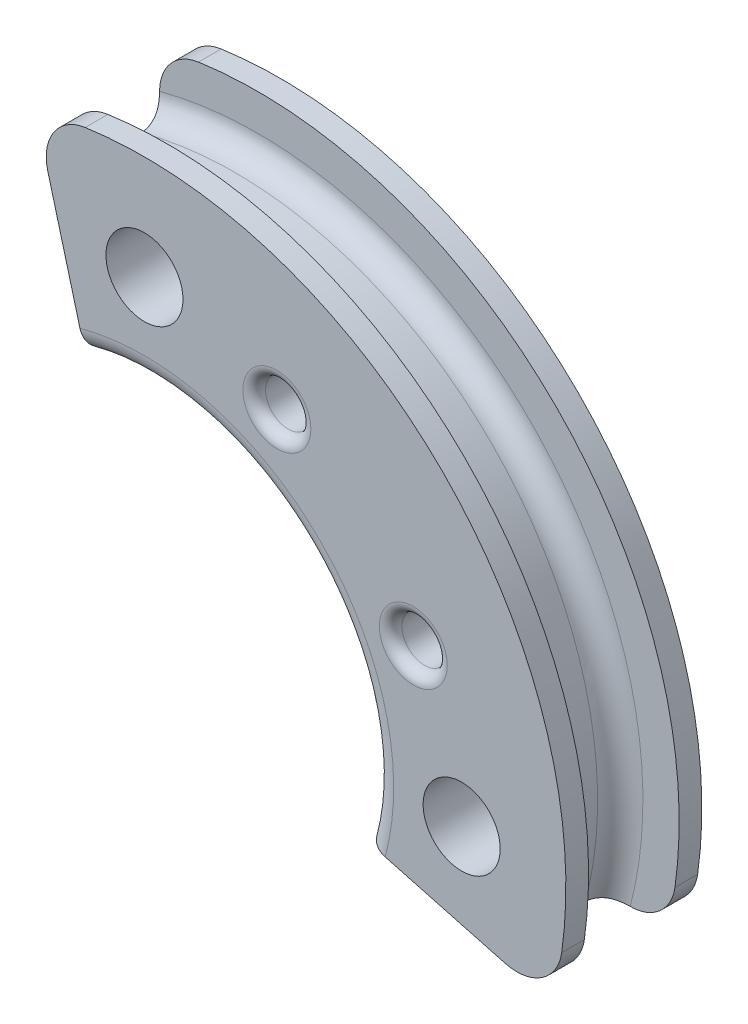
from build123d import *

# Parameters (mm, degrees)
SKETCH1_R               = 8.5
SKETCH1_R_2             = 0.85
SKETCH1_R_3             = 5
BOSS_EXTRUDE1_DEPTH     = 1.5
SKETCH7_W               = 0.8
SKETCH7_H               = 0.5
CUT_EXTRUDE1_DEPTH      = 14.237446884
CUT_EXTRUDE1_DEPTH_BACK = 14.237446884
CUT_EXTRUDE2_DEPTH      = 14.489996294
CUT_EXTRUDE2_DEPTH_BACK = 14.489996294
SKETCH5_R               = 0.5
FILLET1_R               = 0.5
FILLET2_R               = 1
CHAMFER1_SIZE           = 0.8
FILLET3_R               = 0.25


with BuildPart() as part:
    # Sketch1 → Boss-Extrude1 (new, symmetric)
    with BuildSketch(Plane.XY):
        Circle(SKETCH1_R)
        with Locations((7, 0)):
            Circle(SKETCH1_R_2, mode=Mode.SUBTRACT)
        Circle(SKETCH1_R_3, mode=Mode.SUBTRACT)
        with Locations((0, -7)):
            Circle(SKETCH1_R_2, mode=Mode.SUBTRACT)
        with Locations((-7, 0)):
            Circle(SKETCH1_R_2, mode=Mode.SUBTRACT)
        with Locations((0, 7)):
            Circle(SKETCH1_R_2, mode=Mode.SUBTRACT)
    extrude(amount=BOSS_EXTRUDE1_DEPTH, both=True)

    # Sketch2 → Cut-Revolve1 (revolve, cut)
    with BuildSketch(Plane(origin=(0, 0, 0), x_dir=(1, 0, 0), z_dir=(0, 1, 0)), mode=Mode.PRIVATE) as cut_revolve1_sk:
        with BuildLine():
            Line((-8, 0.5), (-8, -0.5))
            ThreePointArc((-8, -0.5), (-8.146446609, -0.853553391), (-8.5, -1))
            Line((-8.5, -1), (-8.5, 1))
            ThreePointArc((-8.5, 1), (-8.146446609, 0.853553391), (-8, 0.5))
        make_face()
    revolve(cut_revolve1_sk.sketch.rotate(Axis((0, 0, 0), (0, 0, -1)), 180), axis=Axis((0, 0, 0), (0, 0, -1)), mode=Mode.SUBTRACT)

    # Sketch7 → Revolve1 (revolve)
    with BuildSketch(Plane(origin=(0, 0, 0), x_dir=(1, 0, 0), z_dir=(0, 1, 0))):
        with Locations((8.9, 1.25)):
            Rectangle(SKETCH7_W, SKETCH7_H)
        with Locations((8.9, -1.25)):
            Rectangle(SKETCH7_W, SKETCH7_H)
    revolve(axis=Axis((0, 0, 0), (0, 0, -1)))

    # Sketch4 → Cut-Extrude1 (cut, two sides: drawn at the far end of the back side and taken through both)
    with BuildSketch(Plane.XY.offset(-CUT_EXTRUDE1_DEPTH_BACK)):
        Polygon((-2.654263152, 9.905844942), (0, 0), (10.350145374, -2.773313095), (10.350145374, -11.033622271), (-11.334173843, -11.033622271), (-11.334173843, 9.905844942), align=None)
    extrude(amount=CUT_EXTRUDE1_DEPTH + CUT_EXTRUDE1_DEPTH_BACK, mode=Mode.SUBTRACT)

    # Sketch5 → Cut-Extrude2 (cut, two sides: drawn at the far end of the back side and taken through both)
    with BuildSketch(Plane.XY.offset(1.5).offset(-CUT_EXTRUDE2_DEPTH_BACK)):
        with Locations((2.922350839, 5.932300352)):
            Circle(SKETCH5_R)
        with Locations((5.932300352, 2.922350839)):
            Circle(SKETCH5_R)
    extrude(amount=CUT_EXTRUDE2_DEPTH + CUT_EXTRUDE2_DEPTH_BACK, mode=Mode.SUBTRACT)

    # Fillet1
    fillet1_edges = [part.edges().sort_by_distance(p)[0] for p in [
        (3.535533906, 3.535533906, 1.5),
        (3.535533906, 3.535533906, -1.5),
    ]]
    fillet(fillet1_edges, radius=FILLET1_R)

    # Fillet2
    fillet2_edges = [part.edges().sort_by_distance(p)[0] for p in [
        (8.983110184, -2.407017119, -1.25),
        (8.983110184, -2.407017119, 1.25),
        (-2.407017119, 8.983110184, -1.25),
        (-2.407017119, 8.983110184, 1.25),
    ]]
    fillet(fillet2_edges, radius=FILLET2_R)

    # Chamfer1
    # the kernel refuses this chamfer: 0.8 mm, written as the material it takes off along each edge
    with BuildSketch(Plane(origin=(7, 0, -1.5), x_dir=(1, 0, 0), z_dir=(0, -1, 0))) as chamfer1_piece_1:
        Polygon((0.85 + CHAMFER1_SIZE, 0), (0.85, CHAMFER1_SIZE), (0.85, 0), align=None)
    revolve(axis=Axis((7, 0, -1.5), (0, 0, 1)), mode=Mode.SUBTRACT)
    with BuildSketch(Plane(origin=(0, 7, -1.5), x_dir=(1, 0, 0), z_dir=(0, -1, 0))) as chamfer1_piece_2:
        Polygon((0.85 + CHAMFER1_SIZE, 0), (0.85, CHAMFER1_SIZE), (0.85, 0), align=None)
    revolve(axis=Axis((0, 7, -1.5), (0, 0, 1)), mode=Mode.SUBTRACT)

    # Fillet3
    fillet3_edges = [part.edges().sort_by_distance(p)[0] for p in [
        (2.422350839, 5.932300352, 1.5),
        (2.422350839, 5.932300352, -1.5),
        (5.432300352, 2.922350839, 1.5),
        (5.432300352, 2.922350839, -1.5),
    ]]
    fillet(fillet3_edges, radius=FILLET3_R)


solid = part.part
